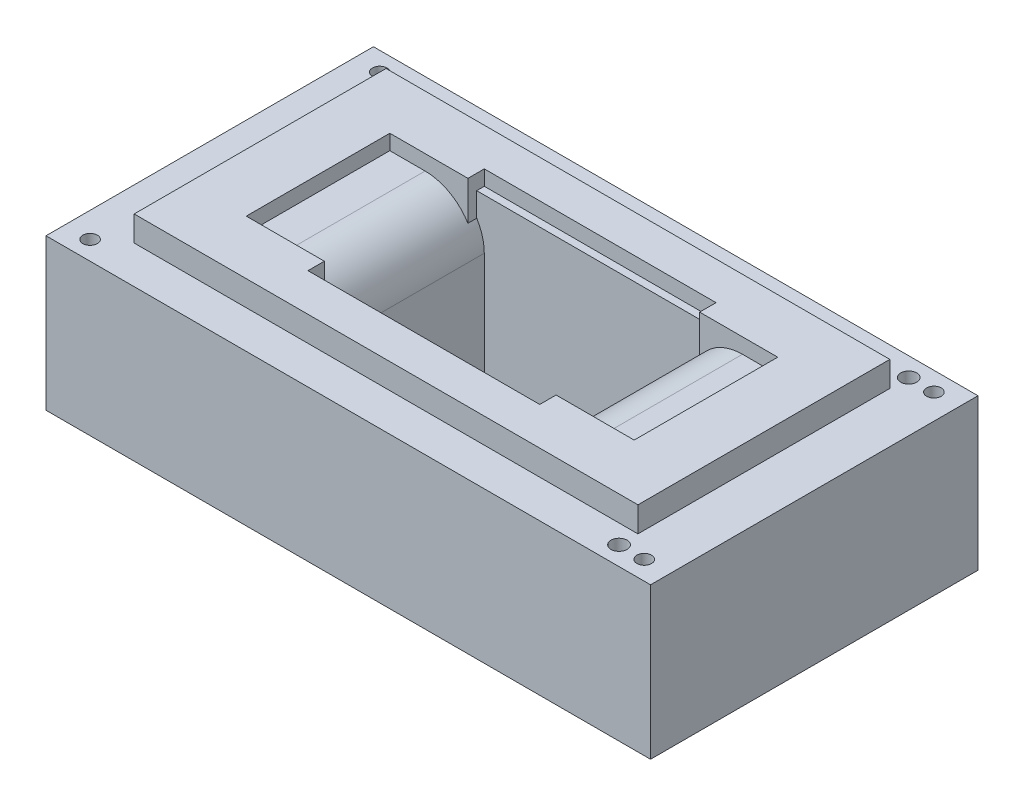
from build123d import *

# Parameters (mm, degrees)
BOSS_EXTRUDE3_DEPTH = 2
SKETCH1_6_W         = 100
SKETCH1_6_H         = 50
BOSS_EXTRUDE4_DEPTH = 5
SKETCH2_W           = 120
SKETCH2_H           = 65
SKETCH2_R           = 1.45
SKETCH2_R_2         = 1.6
BOSS_EXTRUDE5_DEPTH = 30
SKETCH2_2_W         = 120
SKETCH2_2_H         = 65
SKETCH2_2_R         = 1.45
SKETCH2_2_R_2       = 1.6
BOSS_EXTRUDE6_DEPTH = 3
CUT_EXTRUDE1_REACH  = 77.367
SKETCH7_W           = 43
SKETCH7_H           = 32
FILLET1_R           = 10


with BuildPart() as part:
    # Sketch1 → Boss-Extrude3 (new body)
    with BuildSketch(Plane(origin=(0, 0, 0), x_dir=(1, 0, 0), z_dir=(0, 1, 0))):
        Polygon((23, -14.25), (23, -17.5), (-23, -17.5), (-23, -14.25), (-38.5, -14.25), (-38.5, 14.25), (-23, 14.25), (-23, 17.5), (23, 17.5), (23, 14.25), (38.5, 14.25), (38.5, -14.25), align=None)
    extrude(amount=BOSS_EXTRUDE3_DEPTH)

    # Sketch1<6> → Boss-Extrude4 (add)
    with BuildSketch(Plane(origin=(0, 0, 0), x_dir=(1, 0, 0), z_dir=(0, 1, 0))):
        Rectangle(SKETCH1_6_W, SKETCH1_6_H)
        Polygon((23, -14.25), (23, -17.5), (-23, -17.5), (-23, -14.25), (-38.5, -14.25), (-38.5, 14.25), (-23, 14.25), (-23, 17.5), (23, 17.5), (23, 14.25), (38.5, 14.25), (38.5, -14.25), align=None, mode=Mode.SUBTRACT)
    extrude(amount=BOSS_EXTRUDE4_DEPTH)

    # Sketch2 → Boss-Extrude5 (add)
    with BuildSketch(Plane.XZ):
        Rectangle(SKETCH2_W, SKETCH2_H)
        with Locations(Location((-55, 28.75, 0), (0, 0, 270))):
            Circle(SKETCH2_R, mode=Mode.SUBTRACT)
        with Locations(Location((55, 28.75, 0), (0, 0, 90))):
            Circle(SKETCH2_R, mode=Mode.SUBTRACT)
        with Locations(Location((55, -28.75, 0), (0, 0, 270))):
            Circle(SKETCH2_R, mode=Mode.SUBTRACT)
        with Locations(Location((-55, -28.75, 0), (0, 0, 90))):
            Circle(SKETCH2_R, mode=Mode.SUBTRACT)
        with Locations(Location((50, 28.75, 0), (0, 0, 270))):
            Circle(SKETCH2_R_2, mode=Mode.SUBTRACT)
        with Locations(Location((50, -28.75, 0), (0, 0, 90))):
            Circle(SKETCH2_R_2, mode=Mode.SUBTRACT)
    extrude(amount=BOSS_EXTRUDE5_DEPTH)

    # Sketch2<2> → Boss-Extrude6 (add)
    with BuildSketch(Plane.XZ):
        Rectangle(SKETCH2_2_W, SKETCH2_2_H)
        with Locations(Location((-55, 28.75, 0), (0, 0, 270))):
            Circle(SKETCH2_2_R, mode=Mode.SUBTRACT)
        with Locations(Location((55, 28.75, 0), (0, 0, 90))):
            Circle(SKETCH2_2_R, mode=Mode.SUBTRACT)
        with Locations(Location((55, -28.75, 0), (0, 0, 270))):
            Circle(SKETCH2_2_R, mode=Mode.SUBTRACT)
        with Locations(Location((-55, -28.75, 0), (0, 0, 90))):
            Circle(SKETCH2_2_R, mode=Mode.SUBTRACT)
        with Locations(Location((50, 28.75, 0), (0, 0, 270))):
            Circle(SKETCH2_2_R_2, mode=Mode.SUBTRACT)
        with Locations(Location((50, -28.75, 0), (0, 0, 90))):
            Circle(SKETCH2_2_R_2, mode=Mode.SUBTRACT)
    extrude(amount=BOSS_EXTRUDE6_DEPTH)

    # Sketch7 → Cut-Extrude1 (cut, up to next)
    with BuildSketch(Plane(origin=(0, 2, 0), x_dir=(1, 0, 0), z_dir=(0, 1, 0)), mode=Mode.PRIVATE) as cut_extrude1_sk1:
        Rectangle(SKETCH7_W, SKETCH7_H)
    cut_extrude1_tool1 = extrude(cut_extrude1_sk1.sketch, amount=-CUT_EXTRUDE1_REACH, mode=Mode.PRIVATE) & part.part
    add(cut_extrude1_tool1.solids().sort_by_distance((0, 2, 0))[0], mode=Mode.SUBTRACT)

    # Fillet1
    # the kernel refuses this fillet: 10 mm, written as the material it takes off along each edge
    with BuildSketch(Plane(origin=(-21.5, 2, 16), x_dir=(0, -1, 0), z_dir=(0, 0, -1))) as fillet1_piece_1_section:
        with BuildLine():
            CenterArc((FILLET1_R, FILLET1_R), FILLET1_R, 180, 90)
            Line((0, FILLET1_R), (0, 0))
            Line((0, 0), (FILLET1_R, 0))
        make_face()
    fillet1_piece_1 = extrude(amount=32, mode=Mode.PRIVATE)
    fillet1_piece_1 = split(fillet1_piece_1, bisect_by=Plane(origin=(-23, -2.387167078, 15.125), z_dir=(1, 0, 0)), keep=Keep.TOP, mode=Mode.PRIVATE)
    add(fillet1_piece_1, mode=Mode.SUBTRACT)
    with BuildSketch(Plane(origin=(-21.5, 2, 41), x_dir=(0, -1, 0), z_dir=(0, 0, -1))) as fillet1_piece_2_section:
        with BuildLine():
            CenterArc((FILLET1_R, FILLET1_R), FILLET1_R, 180, 90)
            Line((0, FILLET1_R), (0, 0))
            Line((0, 0), (FILLET1_R, 0))
        make_face()
    fillet1_piece_2 = extrude(amount=82, mode=Mode.PRIVATE)
    fillet1_piece_2 = split(fillet1_piece_2, bisect_by=Plane(origin=(-23.780995079, -0.852225246, -14.25), z_dir=(0, 0, 1)), keep=Keep.TOP, mode=Mode.PRIVATE)
    fillet1_piece_2 = split(fillet1_piece_2, bisect_by=Plane(origin=(-23.780995079, -0.852225246, 14.25), z_dir=(0, 0, -1)), keep=Keep.TOP, mode=Mode.PRIVATE)
    add(fillet1_piece_2, mode=Mode.SUBTRACT)
    with BuildSketch(Plane(origin=(21.5, 2, -16), x_dir=(0, -1, 0), z_dir=(0, 0, 1))) as fillet1_piece_3_section:
        with BuildLine():
            CenterArc((FILLET1_R, FILLET1_R), FILLET1_R, 180, 90)
            Line((0, FILLET1_R), (0, 0))
            Line((0, 0), (FILLET1_R, 0))
        make_face()
    fillet1_piece_3 = extrude(amount=32, mode=Mode.PRIVATE)
    fillet1_piece_3 = split(fillet1_piece_3, bisect_by=Plane(origin=(23, -2.387167078, -15.125), z_dir=(-1, 0, 0)), keep=Keep.TOP, mode=Mode.PRIVATE)
    add(fillet1_piece_3, mode=Mode.SUBTRACT)
    with BuildSketch(Plane(origin=(21.5, 2, -41), x_dir=(0, -1, 0), z_dir=(0, 0, 1))) as fillet1_piece_4_section:
        with BuildLine():
            CenterArc((FILLET1_R, FILLET1_R), FILLET1_R, 180, 90)
            Line((0, FILLET1_R), (0, 0))
            Line((0, 0), (FILLET1_R, 0))
        make_face()
    fillet1_piece_4 = extrude(amount=82, mode=Mode.PRIVATE)
    fillet1_piece_4 = split(fillet1_piece_4, bisect_by=Plane(origin=(23.780995079, -0.852225246, 14.25), z_dir=(0, 0, -1)), keep=Keep.TOP, mode=Mode.PRIVATE)
    fillet1_piece_4 = split(fillet1_piece_4, bisect_by=Plane(origin=(23.780995079, -0.852225246, -14.25), z_dir=(0, 0, 1)), keep=Keep.TOP, mode=Mode.PRIVATE)
    add(fillet1_piece_4, mode=Mode.SUBTRACT)


solid = part.part
